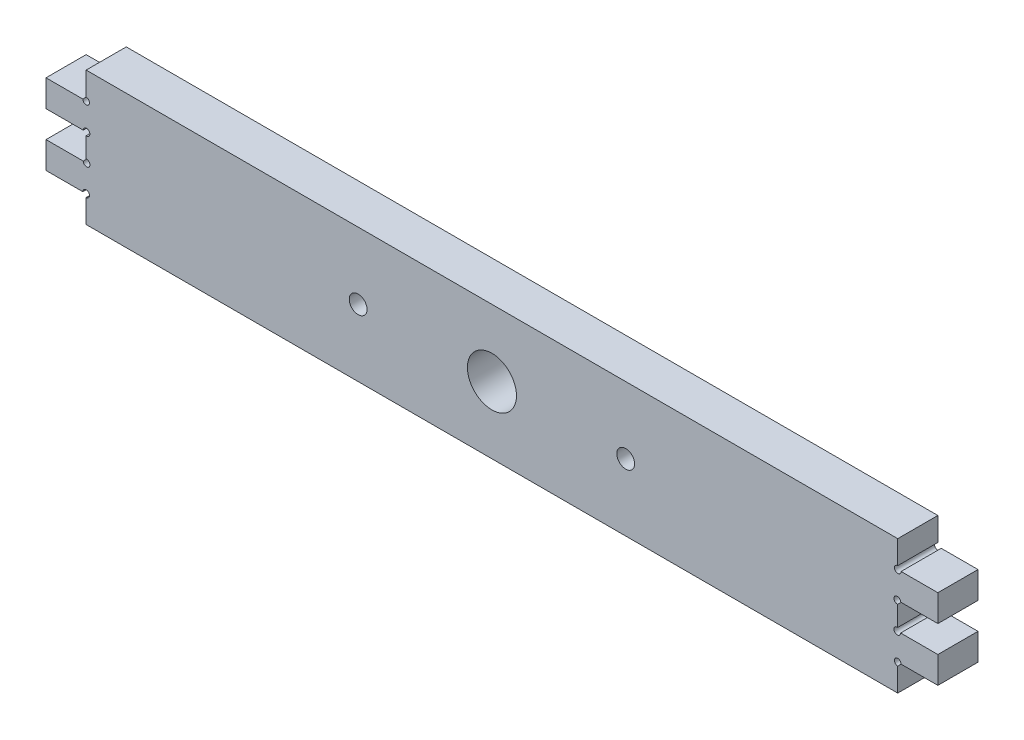
from build123d import *

# Parameters (mm, degrees)
SKETCH1_R           = 4
BOSS_EXTRUDE1_DEPTH = 18
CUT_EXTRUDE1_REACH  = 205.037
SKETCH2_R           = 11


with BuildPart() as part:
    # Sketch1 → Boss-Extrude1 (new body)
    with BuildSketch(Plane.XY):
        with BuildLine():
            Line((-182, -19.500000011), (-182, -30))
            Line((-182, -30), (182, -30))
            Line((182, -30), (182, -19.500000011))
            ThreePointArc((182, -19.500000011), (180.939339824, -16.939339843), (183.5, -18))
            Line((183.5, -18), (200, -18))
            Line((200, -18), (200, -6))
            Line((200, -6), (183.29903814, -6))
            ThreePointArc((183.29903814, -6), (180.665205617, -6.968465906), (182, -4.5))
            Line((182, -4.5), (182, 4.5))
            ThreePointArc((182, 4.5), (180.665205618, 6.968465906), (183.299038141, 6))
            Line((183.299038141, 6), (200, 6))
            Line((200, 6), (200, 18))
            Line((200, 18), (183.5, 18))
            ThreePointArc((183.5, 18), (180.939339828, 16.939339828), (182, 19.5))
            Line((182, 19.5), (182, 30))
            Line((182, 30), (-182, 30))
            Line((-182, 30), (-182, 19.5))
            ThreePointArc((-182, 19.5), (-180.939339828, 16.939339828), (-183.5, 18))
            Line((-183.5, 18), (-200, 18))
            Line((-200, 18), (-200, 6))
            Line((-200, 6), (-183.299038141, 6))
            ThreePointArc((-183.299038141, 6), (-180.665205618, 6.968465906), (-182, 4.5))
            Line((-182, 4.5), (-182, -4.5))
            ThreePointArc((-182, -4.5), (-180.665205617, -6.968465906), (-183.29903814, -6))
            Line((-183.29903814, -6), (-200, -6))
            Line((-200, -6), (-200, -18))
            Line((-200, -18), (-183.5, -18))
            ThreePointArc((-183.5, -18), (-180.939339824, -16.939339843), (-182, -19.500000011))
        make_face()
        with Locations((-60, 0)):
            Circle(SKETCH1_R, mode=Mode.SUBTRACT)
        Circle(SKETCH1_R, mode=Mode.SUBTRACT)
        with Locations((60, 0)):
            Circle(SKETCH1_R, mode=Mode.SUBTRACT)
    extrude(amount=BOSS_EXTRUDE1_DEPTH)

    # Sketch2 → Cut-Extrude1 (cut, up to next)
    with BuildSketch(Plane.XY.offset(18), mode=Mode.PRIVATE) as cut_extrude1_sk1:
        Circle(SKETCH2_R)
    cut_extrude1_tool1 = extrude(cut_extrude1_sk1.sketch, amount=-CUT_EXTRUDE1_REACH, mode=Mode.PRIVATE) & part.part
    add(cut_extrude1_tool1.solids().sort_by_distance((0, 0, 18))[0], mode=Mode.SUBTRACT)


solid = part.part
